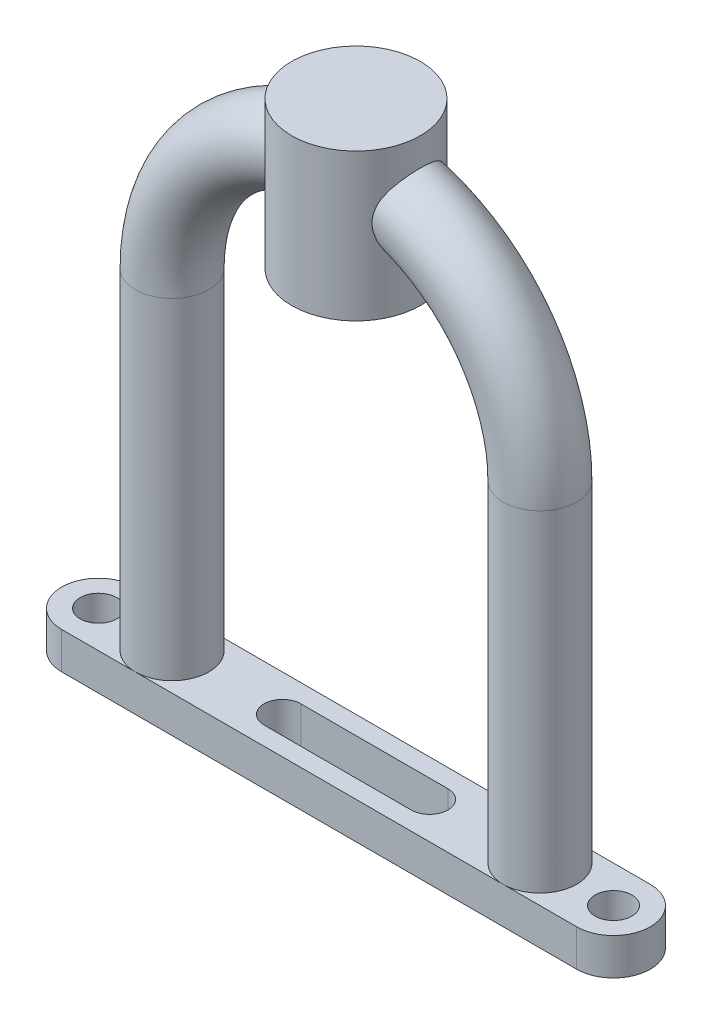
from build123d import *

# Parameters (mm, degrees)
ESBO_O1_R                = 0.25
RESSALTO_EXTRUS_O1_DEPTH = 0.25
ESBO_O3_R                = 0.5
ESBO_O4_R                = 0.875
RESSALTO_EXTRUS_O4_DEPTH = 2


with BuildPart() as part:
    # Esboço1 → Ressalto-extrusão1 (new, symmetric)
    with BuildSketch(Plane(origin=(0, 0, 0), x_dir=(1, 0, 0), z_dir=(0, 1, 0))):
        with BuildLine():
            Line((-3.5, 0.5), (3.5, 0.5))
            ThreePointArc((3.5, 0.5), (4, 0), (3.5, -0.5))
            Line((3.5, -0.5), (-3.5, -0.5))
            ThreePointArc((-3.5, -0.5), (-4, 0), (-3.5, 0.5))
        make_face()
        with Locations((3.5, 0)):
            Circle(ESBO_O1_R, mode=Mode.SUBTRACT)
        with Locations((-3.5, 0)):
            Circle(ESBO_O1_R, mode=Mode.SUBTRACT)
        with BuildLine():
            Line((-1, 0.25), (1, 0.25))
            ThreePointArc((1, 0.25), (1.25, 0), (1, -0.25))
            Line((1, -0.25), (-1, -0.25))
            ThreePointArc((-1, -0.25), (-1.25, 0), (-1, 0.25))
        make_face(mode=Mode.SUBTRACT)
    extrude(amount=RESSALTO_EXTRUS_O1_DEPTH, both=True)

    # Varredura1: sweep along a path in Esboço2
    with BuildLine(Plane.XY) as varredura1_path:
        Line((-2.5, 0.25), (-2.5, 4.75))
        ThreePointArc((-2.5, 4.75), (0, 7.25), (2.5, 4.75))
        Line((2.5, 4.75), (2.5, 0.25))
    # Esboço3 → Varredura1 (sweep)
    with BuildSketch(Plane(origin=(0, 0.25, 0), x_dir=(1, 0, 0), z_dir=(0, 1, 0))):
        with Locations((-2.5, 0)):
            Circle(ESBO_O3_R)
    sweep(path=varredura1_path.line)


with BuildPart() as body_2:
    # Esboço4 → Ressalto-extrusão4 (new body)
    with BuildSketch(Plane(origin=(0, 8, 0), x_dir=(1, 0, 0), z_dir=(0, 1, 0))):
        Circle(ESBO_O4_R)
    extrude(amount=-RESSALTO_EXTRUS_O4_DEPTH)


solid = Compound([part.part, body_2.part])
